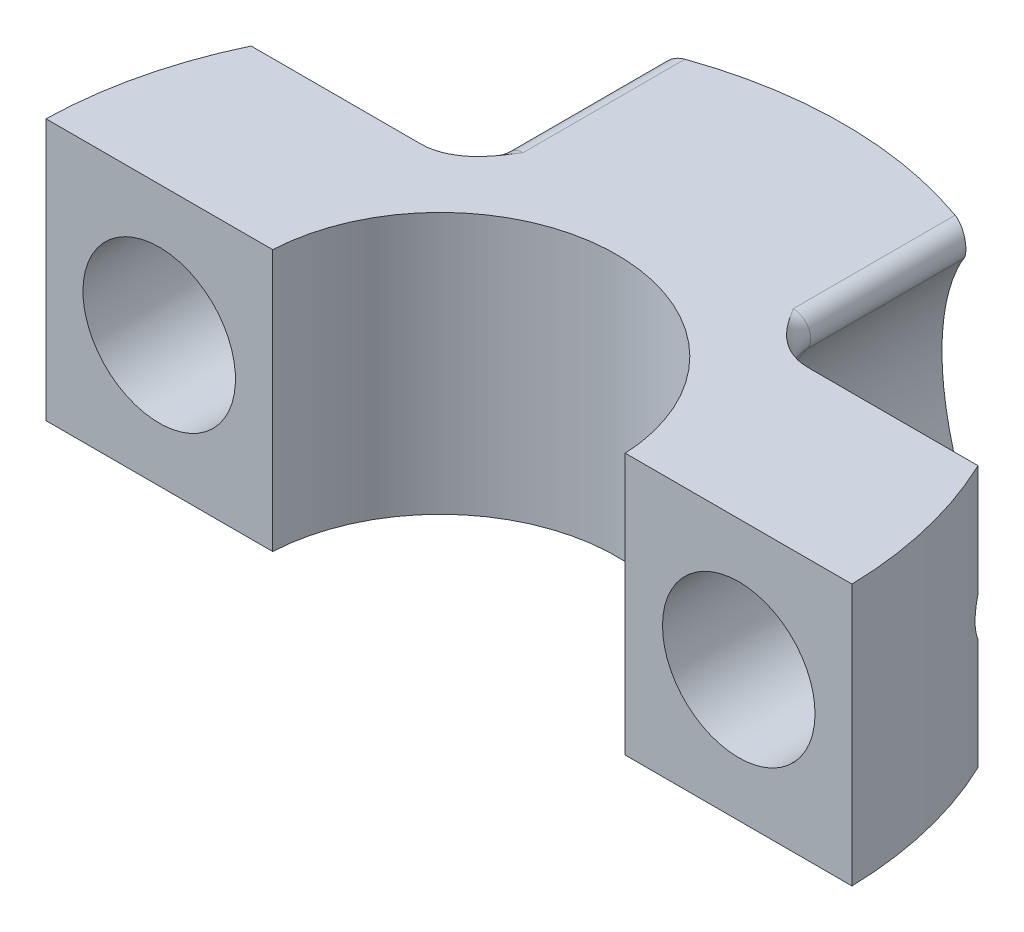
from build123d import *

# Parameters (mm, degrees)
BOSS_EXTRUDE1_DEPTH     = 3
CUT_EXTRUDE1_DEPTH      = 14.421065531
CUT_EXTRUDE1_DEPTH_BACK = 14.421065531
SKETCH2_R               = 1.75
SKETCH3_R               = 4
CUT_EXTRUDE2_DEPTH      = 6
FILLET1_R               = 0.4
FILLET2_R               = 1
CUT_EXTRUDE3_DEPTH      = 15.391838135
CUT_EXTRUDE3_DEPTH_BACK = 15.391838135
SKETCH4_W               = 19
SKETCH4_H               = 0.4


with BuildPart() as part:
    # Sketch1 → Boss-Extrude1 (new, symmetric)
    with BuildSketch(Plane(origin=(0, 0, 0), x_dir=(1, 0, 0), z_dir=(0, 1, 0))):
        with BuildLine():
            Line((-4.05, 0), (-9.25, 0))
            ThreePointArc((-9.25, 0), (0, 9.25), (9.25, 0))
            Line((9.25, 0), (4.05, 0))
            ThreePointArc((4.05, 0), (0, 4.05), (-4.05, 0))
        make_face()
    extrude(amount=BOSS_EXTRUDE1_DEPTH, both=True)

    # Sketch2 → Cut-Extrude1 (cut, two sides: drawn at the far end of the back side and taken through both)
    with BuildSketch(Plane.XY.offset(-CUT_EXTRUDE1_DEPTH_BACK)):
        with Locations((6.65, 0)):
            Circle(SKETCH2_R)
        with Locations((-6.65, 0)):
            Circle(SKETCH2_R)
    extrude(amount=CUT_EXTRUDE1_DEPTH + CUT_EXTRUDE1_DEPTH_BACK, mode=Mode.SUBTRACT)

    # Sketch3 → Cut-Extrude2 (cut)
    with BuildSketch(Plane.XY.offset(-10)):
        with Locations((6.65, 0)):
            Circle(SKETCH3_R)
        with Locations((-6.65, 0)):
            Circle(SKETCH3_R)
    extrude(amount=CUT_EXTRUDE2_DEPTH, mode=Mode.SUBTRACT)

    # Fillet1
    # the kernel refuses this fillet: 0.4 mm, written as the material it takes off along each edge
    with BuildSketch(Plane(origin=(-4.004248689, 3, -4), x_dir=(0.6743792283231849, -0.7383851680567708, 0), z_dir=(0, 0, -1)), Plane(origin=(4.004248689, -3, -4), x_dir=(-0.6743792283231826, 0.7383851680567729, 0), z_dir=(0, 0, -1))) as fillet1_piece_1:
        with BuildLine():
            CenterArc((0.904923131, -0.397672121), FILLET1_R, 96.184415635, 126.22154662)
            Line((0.609569064, -0.667423812), (0, 0))
            ThreePointArc((0, 0), (0.430915777, -0.023278789), (0.861831553, 0))
        make_face()
    extrude(amount=6.598116085, mode=Mode.SUBTRACT)
    with BuildSketch(Plane(origin=(-4.004248689, -3, -4), x_dir=(0.6743792283231809, 0.7383851680567743, 0), z_dir=(0, 0, -1)), Plane(origin=(4.004248689, 3, -4), x_dir=(-0.6743792283231826, -0.7383851680567729, 0), z_dir=(0, 0, -1))) as fillet1_piece_2:
        with BuildLine():
            CenterArc((0.904923131, 0.397672121), FILLET1_R, 137.594037745, 126.22154662)
            Line((0.609569064, 0.667423812), (0, 0))
            ThreePointArc((0, 0), (0.430915777, 0.023278789), (0.861831553, 0))
        make_face()
    extrude(amount=6.598116085, mode=Mode.SUBTRACT)

    # Fillet2
    # the kernel refuses this fillet: 1 mm, written as the material it adds along each edge
    with BuildSketch(Plane(origin=(-6.65, 0, -4), x_dir=(0.8067381522408935, -0.5909090909090408, 0), z_dir=(-0.5909090909090408, -0.8067381522408935, 0))) as fillet2_piece_1:
        with BuildLine():
            CenterArc((4 - FILLET2_R, -FILLET2_R), FILLET2_R, 0, 90)
            Line((4, -FILLET2_R), (4, 0))
            Line((4, 0), (4 - FILLET2_R, 0))
        make_face()
    revolve(axis=Axis((-6.65, 0, -4), (0, 0, 1)), revolution_arc=72.44309324)
    with BuildSketch(Plane(origin=(6.65, 0, -4), x_dir=(-0.8067381522408924, 0.5909090909090423, 0), z_dir=(0.5909090909090423, 0.8067381522408924, 0))) as fillet2_piece_2:
        with BuildLine():
            CenterArc((4 - FILLET2_R, -FILLET2_R), FILLET2_R, 0, 90)
            Line((4, -FILLET2_R), (4, 0))
            Line((4, 0), (4 - FILLET2_R, 0))
        make_face()
    revolve(axis=Axis((6.65, 0, -4), (0, 0, 1)), revolution_arc=72.44309324)
    with BuildSketch(Plane(origin=(-3.10035213, 2.6, -4), x_dir=(-0.8067381522410291, -0.5909090909088556, 0), z_dir=(0.5909090909088556, -0.8067381522410291, 0))) as fillet2_piece_3_section:
        with BuildLine():
            CenterArc((0.4 + FILLET2_R, FILLET2_R), FILLET2_R, 180, 90)
            Line((0.4, FILLET2_R), (0.4, 0))
            Line((0.4, 0), (0.4 + FILLET2_R, 0))
        make_face()
    fillet2_piece_3 = revolve(axis=Axis((-3.10035213, 2.6, -4), (0, 0, -1)), revolution_arc=359.64, mode=Mode.PRIVATE)
    fillet2_piece_3 = split(fillet2_piece_3, bisect_by=Plane(origin=(-3.794786047, 3, -4.154806291), z_dir=(0, -1, 0)), keep=Keep.TOP, mode=Mode.PRIVATE)
    add(fillet2_piece_3)
    with BuildSketch(Plane(origin=(-3.10035213, -2.6, -4), x_dir=(-0.8030094610318433, 0.5959662788223411, 0), z_dir=(-0.5959662788223411, -0.8030094610318433, 0))) as fillet2_piece_4_section:
        with BuildLine():
            CenterArc((-0.4 - FILLET2_R, FILLET2_R), FILLET2_R, 270, 90)
            Line((-0.4 - FILLET2_R, 0), (-0.4, 0))
            Line((-0.4, 0), (-0.4, FILLET2_R))
        make_face()
    fillet2_piece_4 = revolve(axis=Axis((-3.10035213, -2.6, -4), (0, 0, -1)), revolution_arc=359.64, mode=Mode.PRIVATE)
    fillet2_piece_4 = split(fillet2_piece_4, bisect_by=Plane(origin=(-3.549155049, -3, -4.290205519), z_dir=(0, 1, 0)), keep=Keep.TOP, mode=Mode.PRIVATE)
    add(fillet2_piece_4)
    with BuildSketch(Plane(origin=(3.10035213, -2.6, -4), x_dir=(0.8067381522410291, 0.5909090909088556, 0), z_dir=(-0.5909090909088556, 0.8067381522410291, 0))) as fillet2_piece_5_section:
        with BuildLine():
            CenterArc((0.4 + FILLET2_R, FILLET2_R), FILLET2_R, 180, 90)
            Line((0.4, FILLET2_R), (0.4, 0))
            Line((0.4, 0), (0.4 + FILLET2_R, 0))
        make_face()
    fillet2_piece_5 = revolve(axis=Axis((3.10035213, -2.6, -4), (0, 0, -1)), revolution_arc=359.64, mode=Mode.PRIVATE)
    fillet2_piece_5 = split(fillet2_piece_5, bisect_by=Plane(origin=(3.794786054, -3, -4.154806275), z_dir=(0, 1, 0)), keep=Keep.TOP, mode=Mode.PRIVATE)
    add(fillet2_piece_5)
    with BuildSketch(Plane(origin=(3.10035213, 2.6, -4), x_dir=(0.8030094610318433, -0.5959662788223411, 0), z_dir=(0.5959662788223411, 0.8030094610318433, 0))) as fillet2_piece_6_section:
        with BuildLine():
            CenterArc((-0.4 - FILLET2_R, FILLET2_R), FILLET2_R, 270, 90)
            Line((-0.4, FILLET2_R), (-0.4, 0))
            Line((-0.4, 0), (-0.4 - FILLET2_R, 0))
        make_face()
    fillet2_piece_6 = revolve(axis=Axis((3.10035213, 2.6, -4), (0, 0, -1)), revolution_arc=359.64, mode=Mode.PRIVATE)
    fillet2_piece_6 = split(fillet2_piece_6, bisect_by=Plane(origin=(3.549155046, 3, -4.290205778), z_dir=(0, -1, 0)), keep=Keep.TOP, mode=Mode.PRIVATE)
    add(fillet2_piece_6)

    # Sketch4 → Cut-Extrude3 (cut, two sides: drawn at the far end of the back side and taken through both)
    with BuildSketch(Plane(origin=(0, 3, 0), x_dir=(1, 0, 0), z_dir=(0, 1, 0)).offset(-CUT_EXTRUDE3_DEPTH_BACK)):
        Rectangle(SKETCH4_W, SKETCH4_H)
    extrude(amount=CUT_EXTRUDE3_DEPTH + CUT_EXTRUDE3_DEPTH_BACK, mode=Mode.SUBTRACT)


solid = part.part
